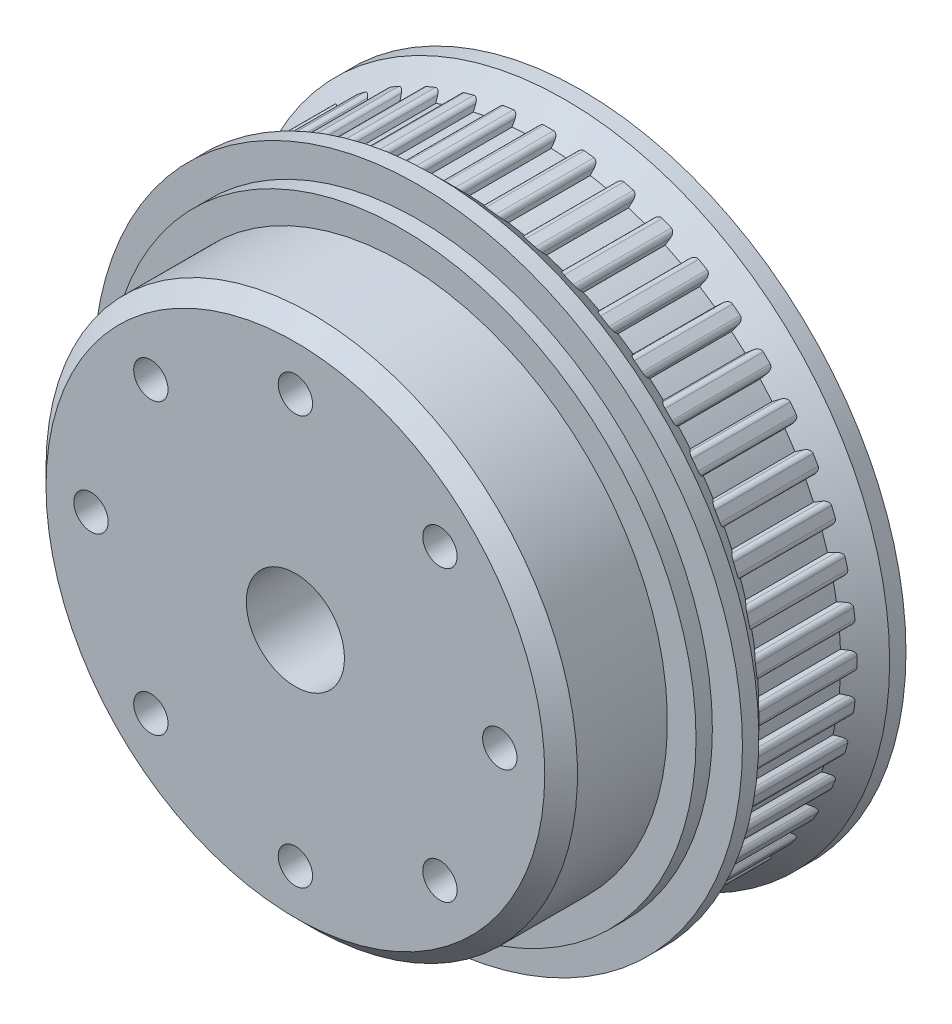
from build123d import *

# Parameters (mm, degrees)
ESQUISSE1_R             = 30
BOSS_EXTRU_1_DEPTH      = 16
BOSS_EXTRU_2_START      = 2
ESQUISSE4_R             = 36
ESQUISSE4_R_2           = 6
BOSS_EXTRU_2_DEPTH      = 2
BOSS_EXTRU_3_START      = 13
ESQUISSE5_R             = 32.5
ESQUISSE5_R_2           = 6
BOSS_EXTRU_3_DEPTH      = 13
ESQUISSE3_R             = 2.1
ENL_V_MAT_EXTRU_1_DEPTH = 67.135396672
CHANFREIN1_SIZE         = 2


with BuildPart() as part:
    # Esquisse1 → Boss.-Extru.1 (new body)
    with BuildSketch(Plane.XY):
        with BuildLine():
            Line((1.335865175, 36.435641743), (3.431368914, 36.298295172))
            Line((3.431368914, 36.298295172), (3.68067617, 37.032730665))
            ThreePointArc((3.68067617, 37.032730665), (3.931993538, 37.349388295), (4.327149963, 37.434733903))
            Line((4.327149963, 37.434733903), (4.918133071, 37.356929501))
            Line((4.918133071, 37.356929501), (5.509116179, 37.279125099))
            ThreePointArc((5.509116179, 37.279125099), (5.868718907, 37.094413563), (6.029515817, 36.723500059))
            Line((6.029515817, 36.723500059), (6.080242241, 35.949564382))
            Line((6.080242241, 35.949564382), (8.13989133, 35.539874706))
            Line((8.13989133, 35.539874706), (8.482928797, 36.235485875))
            ThreePointArc((8.482928797, 36.235485875), (8.773428224, 36.516630956), (9.176343869, 36.549668157))
            Line((9.176343869, 36.549668157), (9.752115522, 36.395390608))
            Line((9.752115522, 36.395390608), (10.327887174, 36.241113058))
            ThreePointArc((10.327887174, 36.241113058), (10.660303758, 36.011044181), (10.771311101, 35.622315685))
            Line((10.771311101, 35.622315685), (10.720584677, 34.848380008))
            Line((10.720584677, 34.848380008), (12.709137949, 34.173357131))
            Line((12.709137949, 34.173357131), (13.140036159, 34.818241876))
            ThreePointArc((13.140036159, 34.818241876), (13.46474712, 35.059063937), (13.868527986, 35.039227455))
            Line((13.868527986, 35.039227455), (14.419236572, 34.81111649))
            Line((14.419236572, 34.81111649), (14.969945157, 34.583005525))
            ThreePointArc((14.969945157, 34.583005525), (15.269487856, 34.311515848), (15.328806266, 33.911623613))
            Line((15.328806266, 33.911623613), (15.177494936, 33.15093019))
            Line((15.177494936, 33.15093019), (17.060927694, 32.22212394))
            Line((17.060927694, 32.22212394), (17.57231386, 32.805248104))
            ThreePointArc((17.57231386, 32.805248104), (17.925680461, 33.001626615), (18.323417745, 32.929255858))
            Line((18.323417745, 32.929255858), (18.839640486, 32.631214519))
            Line((18.839640486, 32.631214519), (19.355863228, 32.33317318))
            ThreePointArc((19.355863228, 32.33317318), (19.617406784, 32.024907966), (19.624021306, 31.620694259))
            Line((19.624021306, 31.620694259), (19.374714049, 30.886258765))
            Line((19.374714049, 30.886258765), (21.120800235, 29.719561276))
            Line((21.120800235, 29.719561276), (21.703924399, 30.230947442))
            ThreePointArc((21.703924399, 30.230947442), (22.079900439, 30.37952231), (22.464788746, 30.255855562))
            Line((22.464788746, 30.255855562), (22.937692929, 29.89298342))
            Line((22.937692929, 29.89298342), (23.410597112, 29.530111277))
            ThreePointArc((23.410597112, 29.530111277), (23.629666442, 29.190345031), (23.5834639, 28.788726059))
            Line((23.5834639, 28.788726059), (23.240426433, 28.093114889))
            Line((23.240426433, 28.093114889), (24.819290029, 26.708488678))
            Line((24.819290029, 26.708488678), (25.464174774, 27.139386888))
            ThreePointArc((25.464174774, 27.139386888), (25.856327198, 27.237615957), (26.221780983, 27.06476919))
            Line((26.221780983, 27.06476919), (26.643275086, 26.643275086))
            Line((26.643275086, 26.643275086), (27.06476919, 26.221780983))
            ThreePointArc((27.06476919, 26.221780983), (27.237615957, 25.856327198), (27.139386888, 25.464174774))
            Line((27.139386888, 25.464174774), (26.708488678, 24.819290029))
            Line((26.708488678, 24.819290029), (28.093114889, 23.240426433))
            Line((28.093114889, 23.240426433), (28.788726059, 23.5834639))
            ThreePointArc((28.788726059, 23.5834639), (29.190345031, 23.629666442), (29.530111277, 23.410597112))
            Line((29.530111277, 23.410597112), (29.89298342, 22.937692929))
            Line((29.89298342, 22.937692929), (30.255855562, 22.464788746))
            ThreePointArc((30.255855562, 22.464788746), (30.37952231, 22.079900439), (30.230947442, 21.703924399))
            Line((30.230947442, 21.703924399), (29.719561276, 21.120800235))
            Line((29.719561276, 21.120800235), (30.886258765, 19.374714049))
            Line((30.886258765, 19.374714049), (31.620694259, 19.624021306))
            ThreePointArc((31.620694259, 19.624021306), (32.024907966, 19.617406784), (32.33317318, 19.355863228))
            Line((32.33317318, 19.355863228), (32.631214519, 18.839640486))
            Line((32.631214519, 18.839640486), (32.929255858, 18.323417745))
            ThreePointArc((32.929255858, 18.323417745), (33.001626615, 17.925680461), (32.805248104, 17.57231386))
            Line((32.805248104, 17.57231386), (32.22212394, 17.060927694))
            Line((32.22212394, 17.060927694), (33.15093019, 15.177494936))
            Line((33.15093019, 15.177494936), (33.911623613, 15.328806266))
            ThreePointArc((33.911623613, 15.328806266), (34.311515848, 15.269487856), (34.583005525, 14.969945157))
            Line((34.583005525, 14.969945157), (34.81111649, 14.419236572))
            Line((34.81111649, 14.419236572), (35.039227455, 13.868527986))
            ThreePointArc((35.039227455, 13.868527986), (35.059063937, 13.46474712), (34.818241876, 13.140036159))
            Line((34.818241876, 13.140036159), (34.173357131, 12.709137949))
            Line((34.173357131, 12.709137949), (34.848380008, 10.720584677))
            Line((34.848380008, 10.720584677), (35.622315685, 10.771311101))
            ThreePointArc((35.622315685, 10.771311101), (36.011044181, 10.660303758), (36.241113058, 10.327887174))
            Line((36.241113058, 10.327887174), (36.395390608, 9.752115522))
            Line((36.395390608, 9.752115522), (36.549668157, 9.176343869))
            ThreePointArc((36.549668157, 9.176343869), (36.516630956, 8.773428224), (36.235485875, 8.482928797))
            Line((36.235485875, 8.482928797), (35.539874706, 8.13989133))
            Line((35.539874706, 8.13989133), (35.949564382, 6.080242241))
            Line((35.949564382, 6.080242241), (36.723500059, 6.029515817))
            ThreePointArc((36.723500059, 6.029515817), (37.094413563, 5.868718907), (37.279125099, 5.509116179))
            Line((37.279125099, 5.509116179), (37.356929501, 4.918133071))
            Line((37.356929501, 4.918133071), (37.434733903, 4.327149963))
            ThreePointArc((37.434733903, 4.327149963), (37.349388295, 3.931993538), (37.032730665, 3.68067617))
            Line((37.032730665, 3.68067617), (36.298295172, 3.431368914))
            Line((36.298295172, 3.431368914), (36.435641743, 1.335865175))
            Line((36.435641743, 1.335865175), (37.196335166, 1.184553846))
            ThreePointArc((37.196335166, 1.184553846), (37.543087245, 0.976718648), (37.679280973, 0.596082678))
            Line((37.679280973, 0.596082678), (37.679280973, 0))
            Line((37.679280973, 0), (37.679280973, -0.596082678))
            ThreePointArc((37.679280973, -0.596082678), (37.543087245, -0.976718648), (37.196335166, -1.184553846))
            Line((37.196335166, -1.184553846), (36.435641743, -1.335865175))
            Line((36.435641743, -1.335865175), (36.298295172, -3.431368914))
            Line((36.298295172, -3.431368914), (37.032730665, -3.68067617))
            ThreePointArc((37.032730665, -3.68067617), (37.349388295, -3.931993538), (37.434733903, -4.327149963))
            Line((37.434733903, -4.327149963), (37.356929501, -4.918133071))
            Line((37.356929501, -4.918133071), (37.279125099, -5.509116179))
            ThreePointArc((37.279125099, -5.509116179), (37.094413563, -5.868718907), (36.723500059, -6.029515817))
            Line((36.723500059, -6.029515817), (35.949564382, -6.080242241))
            Line((35.949564382, -6.080242241), (35.539874706, -8.13989133))
            Line((35.539874706, -8.13989133), (36.235485875, -8.482928797))
            ThreePointArc((36.235485875, -8.482928797), (36.516630956, -8.773428224), (36.549668157, -9.176343869))
            Line((36.549668157, -9.176343869), (36.395390608, -9.752115522))
            Line((36.395390608, -9.752115522), (36.241113058, -10.327887174))
            ThreePointArc((36.241113058, -10.327887174), (36.011044181, -10.660303758), (35.622315685, -10.771311101))
            Line((35.622315685, -10.771311101), (34.848380008, -10.720584677))
            Line((34.848380008, -10.720584677), (34.173357131, -12.709137949))
            Line((34.173357131, -12.709137949), (34.818241876, -13.140036159))
            ThreePointArc((34.818241876, -13.140036159), (35.059063937, -13.46474712), (35.039227455, -13.868527986))
            Line((35.039227455, -13.868527986), (34.81111649, -14.419236572))
            Line((34.81111649, -14.419236572), (34.583005525, -14.969945157))
            ThreePointArc((34.583005525, -14.969945157), (34.311515848, -15.269487856), (33.911623613, -15.328806266))
            Line((33.911623613, -15.328806266), (33.15093019, -15.177494936))
            Line((33.15093019, -15.177494936), (32.22212394, -17.060927694))
            Line((32.22212394, -17.060927694), (32.805248104, -17.57231386))
            ThreePointArc((32.805248104, -17.57231386), (33.001626615, -17.925680461), (32.929255858, -18.323417745))
            Line((32.929255858, -18.323417745), (32.631214519, -18.839640486))
            Line((32.631214519, -18.839640486), (32.33317318, -19.355863228))
            ThreePointArc((32.33317318, -19.355863228), (32.024907966, -19.617406784), (31.620694259, -19.624021306))
            Line((31.620694259, -19.624021306), (30.886258765, -19.374714049))
            Line((30.886258765, -19.374714049), (29.719561276, -21.120800235))
            Line((29.719561276, -21.120800235), (30.230947442, -21.703924399))
            ThreePointArc((30.230947442, -21.703924399), (30.37952231, -22.079900439), (30.255855562, -22.464788746))
            Line((30.255855562, -22.464788746), (29.89298342, -22.937692929))
            Line((29.89298342, -22.937692929), (29.530111277, -23.410597112))
            ThreePointArc((29.530111277, -23.410597112), (29.190345031, -23.629666442), (28.788726059, -23.5834639))
            Line((28.788726059, -23.5834639), (28.093114889, -23.240426433))
            Line((28.093114889, -23.240426433), (26.708488678, -24.819290029))
            Line((26.708488678, -24.819290029), (27.139386888, -25.464174774))
            ThreePointArc((27.139386888, -25.464174774), (27.237615957, -25.856327198), (27.06476919, -26.221780983))
            Line((27.06476919, -26.221780983), (26.643275086, -26.643275086))
            Line((26.643275086, -26.643275086), (26.221780983, -27.06476919))
            ThreePointArc((26.221780983, -27.06476919), (25.856327198, -27.237615957), (25.464174774, -27.139386888))
            Line((25.464174774, -27.139386888), (24.819290029, -26.708488678))
            Line((24.819290029, -26.708488678), (23.240426433, -28.093114889))
            Line((23.240426433, -28.093114889), (23.5834639, -28.788726059))
            ThreePointArc((23.5834639, -28.788726059), (23.629666442, -29.190345031), (23.410597112, -29.530111277))
            Line((23.410597112, -29.530111277), (22.937692929, -29.89298342))
            Line((22.937692929, -29.89298342), (22.464788746, -30.255855562))
            ThreePointArc((22.464788746, -30.255855562), (22.079900439, -30.37952231), (21.703924399, -30.230947442))
            Line((21.703924399, -30.230947442), (21.120800235, -29.719561276))
            Line((21.120800235, -29.719561276), (19.374714049, -30.886258765))
            Line((19.374714049, -30.886258765), (19.624021306, -31.620694259))
            ThreePointArc((19.624021306, -31.620694259), (19.617406784, -32.024907966), (19.355863228, -32.33317318))
            Line((19.355863228, -32.33317318), (18.839640486, -32.631214519))
            Line((18.839640486, -32.631214519), (18.323417745, -32.929255858))
            ThreePointArc((18.323417745, -32.929255858), (17.925680461, -33.001626615), (17.57231386, -32.805248104))
            Line((17.57231386, -32.805248104), (17.060927694, -32.22212394))
            Line((17.060927694, -32.22212394), (15.177494936, -33.15093019))
            Line((15.177494936, -33.15093019), (15.328806266, -33.911623613))
            ThreePointArc((15.328806266, -33.911623613), (15.269487856, -34.311515848), (14.969945157, -34.583005525))
            Line((14.969945157, -34.583005525), (14.419236572, -34.81111649))
            Line((14.419236572, -34.81111649), (13.868527986, -35.039227455))
            ThreePointArc((13.868527986, -35.039227455), (13.46474712, -35.059063937), (13.140036159, -34.818241876))
            Line((13.140036159, -34.818241876), (12.709137949, -34.173357131))
            Line((12.709137949, -34.173357131), (10.720584677, -34.848380008))
            Line((10.720584677, -34.848380008), (10.771311101, -35.622315685))
            ThreePointArc((10.771311101, -35.622315685), (10.660303758, -36.011044181), (10.327887174, -36.241113058))
            Line((10.327887174, -36.241113058), (9.752115522, -36.395390608))
            Line((9.752115522, -36.395390608), (9.176343869, -36.549668157))
            ThreePointArc((9.176343869, -36.549668157), (8.773428224, -36.516630956), (8.482928797, -36.235485875))
            Line((8.482928797, -36.235485875), (8.13989133, -35.539874706))
            Line((8.13989133, -35.539874706), (6.080242241, -35.949564382))
            Line((6.080242241, -35.949564382), (6.029515817, -36.723500059))
            ThreePointArc((6.029515817, -36.723500059), (5.868718907, -37.094413563), (5.509116179, -37.279125099))
            Line((5.509116179, -37.279125099), (4.918133071, -37.356929501))
            Line((4.918133071, -37.356929501), (4.327149963, -37.434733903))
            ThreePointArc((4.327149963, -37.434733903), (3.931993538, -37.349388295), (3.68067617, -37.032730665))
            Line((3.68067617, -37.032730665), (3.431368914, -36.298295172))
            Line((3.431368914, -36.298295172), (1.335865175, -36.435641743))
            Line((1.335865175, -36.435641743), (1.184553846, -37.196335166))
            ThreePointArc((1.184553846, -37.196335166), (0.976718648, -37.543087245), (0.596082678, -37.679280973))
            Line((0.596082678, -37.679280973), (0, -37.679280973))
            Line((0, -37.679280973), (-0.596082678, -37.679280973))
            ThreePointArc((-0.596082678, -37.679280973), (-0.976718648, -37.543087245), (-1.184553846, -37.196335166))
            Line((-1.184553846, -37.196335166), (-1.335865175, -36.435641743))
            Line((-1.335865175, -36.435641743), (-3.431368914, -36.298295172))
            Line((-3.431368914, -36.298295172), (-3.68067617, -37.032730665))
            ThreePointArc((-3.68067617, -37.032730665), (-3.931993538, -37.349388295), (-4.327149963, -37.434733903))
            Line((-4.327149963, -37.434733903), (-4.918133071, -37.356929501))
            Line((-4.918133071, -37.356929501), (-5.509116179, -37.279125099))
            ThreePointArc((-5.509116179, -37.279125099), (-5.868718907, -37.094413563), (-6.029515817, -36.723500059))
            Line((-6.029515817, -36.723500059), (-6.080242241, -35.949564382))
            Line((-6.080242241, -35.949564382), (-8.13989133, -35.539874706))
            Line((-8.13989133, -35.539874706), (-8.482928797, -36.235485875))
            ThreePointArc((-8.482928797, -36.235485875), (-8.773428224, -36.516630956), (-9.176343869, -36.549668157))
            Line((-9.176343869, -36.549668157), (-9.752115522, -36.395390608))
            Line((-9.752115522, -36.395390608), (-10.327887174, -36.241113058))
            ThreePointArc((-10.327887174, -36.241113058), (-10.660303758, -36.011044181), (-10.771311101, -35.622315685))
            Line((-10.771311101, -35.622315685), (-10.720584677, -34.848380008))
            Line((-10.720584677, -34.848380008), (-12.709137949, -34.173357131))
            Line((-12.709137949, -34.173357131), (-13.140036159, -34.818241876))
            ThreePointArc((-13.140036159, -34.818241876), (-13.46474712, -35.059063937), (-13.868527986, -35.039227455))
            Line((-13.868527986, -35.039227455), (-14.419236572, -34.81111649))
            Line((-14.419236572, -34.81111649), (-14.969945157, -34.583005525))
            ThreePointArc((-14.969945157, -34.583005525), (-15.269487856, -34.311515848), (-15.328806266, -33.911623613))
            Line((-15.328806266, -33.911623613), (-15.177494936, -33.15093019))
            Line((-15.177494936, -33.15093019), (-17.060927694, -32.22212394))
            Line((-17.060927694, -32.22212394), (-17.57231386, -32.805248104))
            ThreePointArc((-17.57231386, -32.805248104), (-17.925680461, -33.001626615), (-18.323417745, -32.929255858))
            Line((-18.323417745, -32.929255858), (-18.839640486, -32.631214519))
            Line((-18.839640486, -32.631214519), (-19.355863228, -32.33317318))
            ThreePointArc((-19.355863228, -32.33317318), (-19.617406784, -32.024907966), (-19.624021306, -31.620694259))
            Line((-19.624021306, -31.620694259), (-19.374714049, -30.886258765))
            Line((-19.374714049, -30.886258765), (-21.120800235, -29.719561276))
            Line((-21.120800235, -29.719561276), (-21.703924399, -30.230947442))
            ThreePointArc((-21.703924399, -30.230947442), (-22.079900439, -30.37952231), (-22.464788746, -30.255855562))
            Line((-22.464788746, -30.255855562), (-22.937692929, -29.89298342))
            Line((-22.937692929, -29.89298342), (-23.410597112, -29.530111277))
            ThreePointArc((-23.410597112, -29.530111277), (-23.629666442, -29.190345031), (-23.5834639, -28.788726059))
            Line((-23.5834639, -28.788726059), (-23.240426433, -28.093114889))
            Line((-23.240426433, -28.093114889), (-24.819290029, -26.708488678))
            Line((-24.819290029, -26.708488678), (-25.464174774, -27.139386888))
            ThreePointArc((-25.464174774, -27.139386888), (-25.856327198, -27.237615957), (-26.221780983, -27.06476919))
            Line((-26.221780983, -27.06476919), (-26.643275086, -26.643275086))
            Line((-26.643275086, -26.643275086), (-27.06476919, -26.221780983))
            ThreePointArc((-27.06476919, -26.221780983), (-27.237615957, -25.856327198), (-27.139386888, -25.464174774))
            Line((-27.139386888, -25.464174774), (-26.708488678, -24.819290029))
            Line((-26.708488678, -24.819290029), (-28.093114889, -23.240426433))
            Line((-28.093114889, -23.240426433), (-28.788726059, -23.5834639))
            ThreePointArc((-28.788726059, -23.5834639), (-29.190345031, -23.629666442), (-29.530111277, -23.410597112))
            Line((-29.530111277, -23.410597112), (-29.89298342, -22.937692929))
            Line((-29.89298342, -22.937692929), (-30.255855562, -22.464788746))
            ThreePointArc((-30.255855562, -22.464788746), (-30.37952231, -22.079900439), (-30.230947442, -21.703924399))
            Line((-30.230947442, -21.703924399), (-29.719561276, -21.120800235))
            Line((-29.719561276, -21.120800235), (-30.886258765, -19.374714049))
            Line((-30.886258765, -19.374714049), (-31.620694259, -19.624021306))
            ThreePointArc((-31.620694259, -19.624021306), (-32.024907966, -19.617406784), (-32.33317318, -19.355863228))
            Line((-32.33317318, -19.355863228), (-32.631214519, -18.839640486))
            Line((-32.631214519, -18.839640486), (-32.929255858, -18.323417745))
            ThreePointArc((-32.929255858, -18.323417745), (-33.001626615, -17.925680461), (-32.805248104, -17.57231386))
            Line((-32.805248104, -17.57231386), (-32.22212394, -17.060927694))
            Line((-32.22212394, -17.060927694), (-33.15093019, -15.177494936))
            Line((-33.15093019, -15.177494936), (-33.911623613, -15.328806266))
            ThreePointArc((-33.911623613, -15.328806266), (-34.311515848, -15.269487856), (-34.583005525, -14.969945157))
            Line((-34.583005525, -14.969945157), (-34.81111649, -14.419236572))
            Line((-34.81111649, -14.419236572), (-35.039227455, -13.868527986))
            ThreePointArc((-35.039227455, -13.868527986), (-35.059063937, -13.46474712), (-34.818241876, -13.140036159))
            Line((-34.818241876, -13.140036159), (-34.173357131, -12.709137949))
            Line((-34.173357131, -12.709137949), (-34.848380008, -10.720584677))
            Line((-34.848380008, -10.720584677), (-35.622315685, -10.771311101))
            ThreePointArc((-35.622315685, -10.771311101), (-36.011044181, -10.660303758), (-36.241113058, -10.327887174))
            Line((-36.241113058, -10.327887174), (-36.395390608, -9.752115522))
            Line((-36.395390608, -9.752115522), (-36.549668157, -9.176343869))
            ThreePointArc((-36.549668157, -9.176343869), (-36.516630956, -8.773428224), (-36.235485875, -8.482928797))
            Line((-36.235485875, -8.482928797), (-35.539874706, -8.13989133))
            Line((-35.539874706, -8.13989133), (-35.949564382, -6.080242241))
            Line((-35.949564382, -6.080242241), (-36.723500059, -6.029515817))
            ThreePointArc((-36.723500059, -6.029515817), (-37.094413563, -5.868718907), (-37.279125099, -5.509116179))
            Line((-37.279125099, -5.509116179), (-37.356929501, -4.918133071))
            Line((-37.356929501, -4.918133071), (-37.434733903, -4.327149963))
            ThreePointArc((-37.434733903, -4.327149963), (-37.349388295, -3.931993538), (-37.032730665, -3.68067617))
            Line((-37.032730665, -3.68067617), (-36.298295172, -3.431368914))
            Line((-36.298295172, -3.431368914), (-36.435641743, -1.335865175))
            Line((-36.435641743, -1.335865175), (-37.196335166, -1.184553846))
            ThreePointArc((-37.196335166, -1.184553846), (-37.543087245, -0.976718648), (-37.679280973, -0.596082678))
            Line((-37.679280973, -0.596082678), (-37.679280973, 0))
            Line((-37.679280973, 0), (-37.679280973, 0.596082678))
            ThreePointArc((-37.679280973, 0.596082678), (-37.543087245, 0.976718648), (-37.196335166, 1.184553846))
            Line((-37.196335166, 1.184553846), (-36.435641743, 1.335865175))
            Line((-36.435641743, 1.335865175), (-36.298295172, 3.431368914))
            Line((-36.298295172, 3.431368914), (-37.032730665, 3.68067617))
            ThreePointArc((-37.032730665, 3.68067617), (-37.349388295, 3.931993538), (-37.434733903, 4.327149963))
            Line((-37.434733903, 4.327149963), (-37.356929501, 4.918133071))
            Line((-37.356929501, 4.918133071), (-37.279125099, 5.509116179))
            ThreePointArc((-37.279125099, 5.509116179), (-37.094413563, 5.868718907), (-36.723500059, 6.029515817))
            Line((-36.723500059, 6.029515817), (-35.949564382, 6.080242241))
            Line((-35.949564382, 6.080242241), (-35.539874706, 8.13989133))
            Line((-35.539874706, 8.13989133), (-36.235485875, 8.482928797))
            ThreePointArc((-36.235485875, 8.482928797), (-36.516630956, 8.773428224), (-36.549668157, 9.176343869))
            Line((-36.549668157, 9.176343869), (-36.395390608, 9.752115522))
            Line((-36.395390608, 9.752115522), (-36.241113058, 10.327887174))
            ThreePointArc((-36.241113058, 10.327887174), (-36.011044181, 10.660303758), (-35.622315685, 10.771311101))
            Line((-35.622315685, 10.771311101), (-34.848380008, 10.720584677))
            Line((-34.848380008, 10.720584677), (-34.173357131, 12.709137949))
            Line((-34.173357131, 12.709137949), (-34.818241876, 13.140036159))
            ThreePointArc((-34.818241876, 13.140036159), (-35.059063937, 13.46474712), (-35.039227455, 13.868527986))
            Line((-35.039227455, 13.868527986), (-34.81111649, 14.419236572))
            Line((-34.81111649, 14.419236572), (-34.583005525, 14.969945157))
            ThreePointArc((-34.583005525, 14.969945157), (-34.311515848, 15.269487856), (-33.911623613, 15.328806266))
            Line((-33.911623613, 15.328806266), (-33.15093019, 15.177494936))
            Line((-33.15093019, 15.177494936), (-32.22212394, 17.060927694))
            Line((-32.22212394, 17.060927694), (-32.805248104, 17.57231386))
            ThreePointArc((-32.805248104, 17.57231386), (-33.001626615, 17.925680461), (-32.929255858, 18.323417745))
            Line((-32.929255858, 18.323417745), (-32.631214519, 18.839640486))
            Line((-32.631214519, 18.839640486), (-32.33317318, 19.355863228))
            ThreePointArc((-32.33317318, 19.355863228), (-32.024907966, 19.617406784), (-31.620694259, 19.624021306))
            Line((-31.620694259, 19.624021306), (-30.886258765, 19.374714049))
            Line((-30.886258765, 19.374714049), (-29.719561276, 21.120800235))
            Line((-29.719561276, 21.120800235), (-30.230947442, 21.703924399))
            ThreePointArc((-30.230947442, 21.703924399), (-30.37952231, 22.079900439), (-30.255855562, 22.464788746))
            Line((-30.255855562, 22.464788746), (-29.89298342, 22.937692929))
            Line((-29.89298342, 22.937692929), (-29.530111277, 23.410597112))
            ThreePointArc((-29.530111277, 23.410597112), (-29.190345031, 23.629666442), (-28.788726059, 23.5834639))
            Line((-28.788726059, 23.5834639), (-28.093114889, 23.240426433))
            Line((-28.093114889, 23.240426433), (-26.708488678, 24.819290029))
            Line((-26.708488678, 24.819290029), (-27.139386888, 25.464174774))
            ThreePointArc((-27.139386888, 25.464174774), (-27.237615957, 25.856327198), (-27.06476919, 26.221780983))
            Line((-27.06476919, 26.221780983), (-26.643275086, 26.643275086))
            Line((-26.643275086, 26.643275086), (-26.221780983, 27.06476919))
            ThreePointArc((-26.221780983, 27.06476919), (-25.856327198, 27.237615957), (-25.464174774, 27.139386888))
            Line((-25.464174774, 27.139386888), (-24.819290029, 26.708488678))
            Line((-24.819290029, 26.708488678), (-23.240426433, 28.093114889))
            Line((-23.240426433, 28.093114889), (-23.5834639, 28.788726059))
            ThreePointArc((-23.5834639, 28.788726059), (-23.629666442, 29.190345031), (-23.410597112, 29.530111277))
            Line((-23.410597112, 29.530111277), (-22.937692929, 29.89298342))
            Line((-22.937692929, 29.89298342), (-22.464788746, 30.255855562))
            ThreePointArc((-22.464788746, 30.255855562), (-22.079900439, 30.37952231), (-21.703924399, 30.230947442))
            Line((-21.703924399, 30.230947442), (-21.120800235, 29.719561276))
            Line((-21.120800235, 29.719561276), (-19.374714049, 30.886258765))
            Line((-19.374714049, 30.886258765), (-19.624021306, 31.620694259))
            ThreePointArc((-19.624021306, 31.620694259), (-19.617406784, 32.024907966), (-19.355863228, 32.33317318))
            Line((-19.355863228, 32.33317318), (-18.839640486, 32.631214519))
            Line((-18.839640486, 32.631214519), (-18.323417745, 32.929255858))
            ThreePointArc((-18.323417745, 32.929255858), (-17.925680461, 33.001626615), (-17.57231386, 32.805248104))
            Line((-17.57231386, 32.805248104), (-17.060927694, 32.22212394))
            Line((-17.060927694, 32.22212394), (-15.177494936, 33.15093019))
            Line((-15.177494936, 33.15093019), (-15.328806266, 33.911623613))
            ThreePointArc((-15.328806266, 33.911623613), (-15.269487856, 34.311515848), (-14.969945157, 34.583005525))
            Line((-14.969945157, 34.583005525), (-14.419236572, 34.81111649))
            Line((-14.419236572, 34.81111649), (-13.868527986, 35.039227455))
            ThreePointArc((-13.868527986, 35.039227455), (-13.46474712, 35.059063937), (-13.140036159, 34.818241876))
            Line((-13.140036159, 34.818241876), (-12.709137949, 34.173357131))
            Line((-12.709137949, 34.173357131), (-10.720584677, 34.848380008))
            Line((-10.720584677, 34.848380008), (-10.771311101, 35.622315685))
            ThreePointArc((-10.771311101, 35.622315685), (-10.660303758, 36.011044181), (-10.327887174, 36.241113058))
            Line((-10.327887174, 36.241113058), (-9.752115522, 36.395390608))
            Line((-9.752115522, 36.395390608), (-9.176343869, 36.549668157))
            ThreePointArc((-9.176343869, 36.549668157), (-8.773428224, 36.516630956), (-8.482928797, 36.235485875))
            Line((-8.482928797, 36.235485875), (-8.13989133, 35.539874706))
            Line((-8.13989133, 35.539874706), (-6.080242241, 35.949564382))
            Line((-6.080242241, 35.949564382), (-6.029515817, 36.723500059))
            ThreePointArc((-6.029515817, 36.723500059), (-5.868718907, 37.094413563), (-5.509116179, 37.279125099))
            Line((-5.509116179, 37.279125099), (-4.918133071, 37.356929501))
            Line((-4.918133071, 37.356929501), (-4.327149963, 37.434733903))
            ThreePointArc((-4.327149963, 37.434733903), (-3.931993538, 37.349388295), (-3.68067617, 37.032730665))
            Line((-3.68067617, 37.032730665), (-3.431368914, 36.298295172))
            Line((-3.431368914, 36.298295172), (-1.335865175, 36.435641743))
            Line((-1.335865175, 36.435641743), (-1.184553846, 37.196335166))
            ThreePointArc((-1.184553846, 37.196335166), (-0.976718648, 37.543087245), (-0.596082678, 37.679280973))
            Line((-0.596082678, 37.679280973), (0, 37.679280973))
            Line((0, 37.679280973), (0.596082678, 37.679280973))
            ThreePointArc((0.596082678, 37.679280973), (0.976718648, 37.543087245), (1.184553846, 37.196335166))
            Line((1.184553846, 37.196335166), (1.335865175, 36.435641743))
        make_face()
        Circle(ESQUISSE1_R, mode=Mode.SUBTRACT)
    extrude(amount=BOSS_EXTRU_1_DEPTH)

    # Esquisse2 → Révolution1 (revolve)
    with BuildSketch(Plane(origin=(0, 0, 0), x_dir=(1, 0, 0), z_dir=(0, 1, 0))):
        Polygon((-6, 2), (-6, -18), (-39.679280973, -18), (-39.679280973, -16), (-36.679280973, -13), (-36.679280973, -3), (-39.679280973, 0), (-39.679280973, 2), align=None)
    revolve(axis=Axis((0, 0, 0), (0, 0, 1)))

    # Esquisse4 → Boss.-Extru.2 (add)
    with BuildSketch(Plane.XY.offset(18).offset(BOSS_EXTRU_2_START)):
        Circle(ESQUISSE4_R)
        Circle(ESQUISSE4_R_2, mode=Mode.SUBTRACT)
    extrude(amount=-BOSS_EXTRU_2_DEPTH)

    # Esquisse5 → Boss.-Extru.3 (add)
    with BuildSketch(Plane.XY.offset(20).offset(BOSS_EXTRU_3_START)):
        Circle(ESQUISSE5_R)
        Circle(ESQUISSE5_R_2, mode=Mode.SUBTRACT)
    extrude(amount=-BOSS_EXTRU_3_DEPTH)

    # Esquisse3 → Enlèv. mat.-Extru.1 (cut, through all)
    with BuildSketch(Plane(origin=(0, 0, -2), x_dir=(-1, 0, 0), z_dir=(0, 0, -1))):
        with Locations((0, 25)):
            Circle(ESQUISSE3_R)
        with Locations((17.67766953, 17.67766953)):
            Circle(ESQUISSE3_R)
        with Locations((25, 0)):
            Circle(ESQUISSE3_R)
        with Locations((17.67766953, -17.67766953)):
            Circle(ESQUISSE3_R)
        with Locations((0, -25)):
            Circle(ESQUISSE3_R)
        with Locations((-17.67766953, -17.67766953)):
            Circle(ESQUISSE3_R)
        with Locations((-25, 0)):
            Circle(ESQUISSE3_R)
        with Locations((-17.67766953, 17.67766953)):
            Circle(ESQUISSE3_R)
    extrude(amount=-ENL_V_MAT_EXTRU_1_DEPTH, mode=Mode.SUBTRACT)

    # Chanfrein1
    chanfrein1_edges = [part.edges().sort_by_distance(p)[0] for p in [
        (-32.5, 0, 33),
    ]]
    chamfer(chanfrein1_edges, length=CHANFREIN1_SIZE)


solid = part.part
